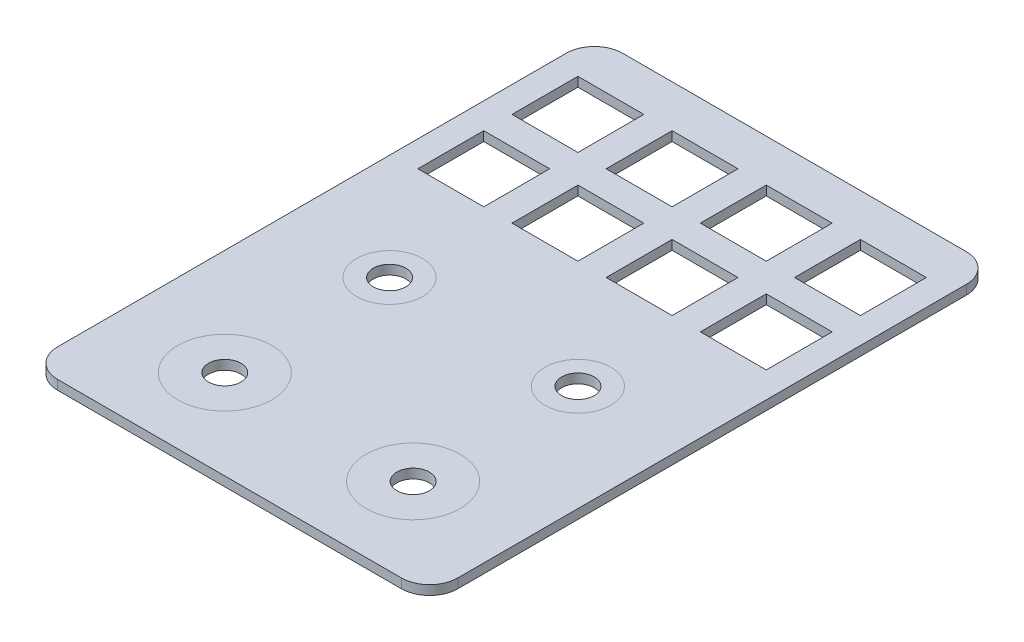
from build123d import *

# Parameters (mm, degrees)
ESQUISSE1_W             = 85
ESQUISSE1_H             = 120
BOSS_EXTRU_1_DEPTH      = 2
ESQUISSE2_W             = 14
ESQUISSE2_H             = 14
ENL_V_MAT_EXTRU_1_DEPTH = 2
ESQUISSE3_R             = 7
ESQUISSE3_R_2           = 10
ENL_V_MAT_EXTRU_2_DEPTH = 2
CONG_1_R                = 6
ESQUISSE4_R             = 7
ESQUISSE4_R_2           = 3.45
BOSS_EXTRU_2_DEPTH      = 2
ESQUISSE4_R_3           = 10
BOSS_EXTRU_2_2_DEPTH    = 2
BOSS_EXTRU_2_3_DEPTH    = 2
BOSS_EXTRU_2_4_DEPTH    = 2


with BuildPart() as part:
    # Esquisse1 → Boss.-Extru.1 (new body)
    with BuildSketch(Plane(origin=(0, 0, 0), x_dir=(1, 0, 0), z_dir=(0, 1, 0))):
        Rectangle(ESQUISSE1_W, ESQUISSE1_H)
    extrude(amount=BOSS_EXTRU_1_DEPTH)

    # Esquisse2 → Enlèv. mat.-Extru.1 (cut)
    with BuildSketch(Plane(origin=(0, 2, 0), x_dir=(1, 0, 0), z_dir=(0, 1, 0))):
        with Locations((-30, 44)):
            Rectangle(ESQUISSE2_W, ESQUISSE2_H)
        with Locations((-10, 44)):
            Rectangle(ESQUISSE2_W, ESQUISSE2_H)
        with Locations((10, 44)):
            Rectangle(ESQUISSE2_W, ESQUISSE2_H)
        with Locations((30, 44)):
            Rectangle(ESQUISSE2_W, ESQUISSE2_H)
        with Locations((30, 24)):
            Rectangle(ESQUISSE2_W, ESQUISSE2_H)
        with Locations((10, 24)):
            Rectangle(ESQUISSE2_W, ESQUISSE2_H)
        with Locations((-10, 24)):
            Rectangle(ESQUISSE2_W, ESQUISSE2_H)
        with Locations((-30, 24)):
            Rectangle(ESQUISSE2_W, ESQUISSE2_H)
    extrude(amount=-ENL_V_MAT_EXTRU_1_DEPTH, mode=Mode.SUBTRACT)

    # Esquisse3 → Enlèv. mat.-Extru.2 (cut)
    with BuildSketch(Plane(origin=(0, 2, 0), x_dir=(1, 0, 0), z_dir=(0, 1, 0))):
        with Locations((-20, -6)):
            Circle(ESQUISSE3_R)
        with Locations((-20, -41)):
            Circle(ESQUISSE3_R_2)
        with Locations((20, -6)):
            Circle(ESQUISSE3_R)
        with Locations((20, -41)):
            Circle(ESQUISSE3_R_2)
    extrude(amount=-ENL_V_MAT_EXTRU_2_DEPTH, mode=Mode.SUBTRACT)

    # Congé1
    cong_1_edges = [part.edges().sort_by_distance(p)[0] for p in [
        (42.5, 1, 60),
        (-42.5, 1, 60),
        (-42.5, 1, -60),
        (42.5, 1, -60),
    ]]
    fillet(cong_1_edges, radius=CONG_1_R)


with BuildPart() as body_2:
    # Esquisse4 → Boss.-Extru.2 (new body)
    with BuildSketch(Plane(origin=(0, 2, 0), x_dir=(1, 0, 0), z_dir=(0, 1, 0))):
        with Locations((-20, -6)):
            Circle(ESQUISSE4_R)
        with Locations((-20, -6)):
            Circle(ESQUISSE4_R_2, mode=Mode.SUBTRACT)
    extrude(amount=-BOSS_EXTRU_2_DEPTH)


with BuildPart() as body_3:
    # Esquisse4 → Boss.-Extru.2 2 (new body)
    with BuildSketch(Plane(origin=(0, 2, 0), x_dir=(1, 0, 0), z_dir=(0, 1, 0))):
        with Locations((-20, -41)):
            Circle(ESQUISSE4_R_3)
        with Locations((-20, -41)):
            Circle(ESQUISSE4_R_2, mode=Mode.SUBTRACT)
    extrude(amount=-BOSS_EXTRU_2_2_DEPTH)


with BuildPart() as body_4:
    # Esquisse4 → Boss.-Extru.2 3 (new body)
    with BuildSketch(Plane(origin=(0, 2, 0), x_dir=(1, 0, 0), z_dir=(0, 1, 0))):
        with Locations((20, -41)):
            Circle(ESQUISSE4_R_3)
        with Locations((20, -41)):
            Circle(ESQUISSE4_R_2, mode=Mode.SUBTRACT)
    extrude(amount=-BOSS_EXTRU_2_3_DEPTH)


with BuildPart() as body_5:
    # Esquisse4 → Boss.-Extru.2 4 (new body)
    with BuildSketch(Plane(origin=(0, 2, 0), x_dir=(1, 0, 0), z_dir=(0, 1, 0))):
        with Locations((20, -6)):
            Circle(ESQUISSE4_R)
        with Locations((20, -6)):
            Circle(ESQUISSE4_R_2, mode=Mode.SUBTRACT)
    extrude(amount=-BOSS_EXTRU_2_4_DEPTH)


solid = Compound([part.part, body_2.part, body_3.part, body_4.part, body_5.part])
